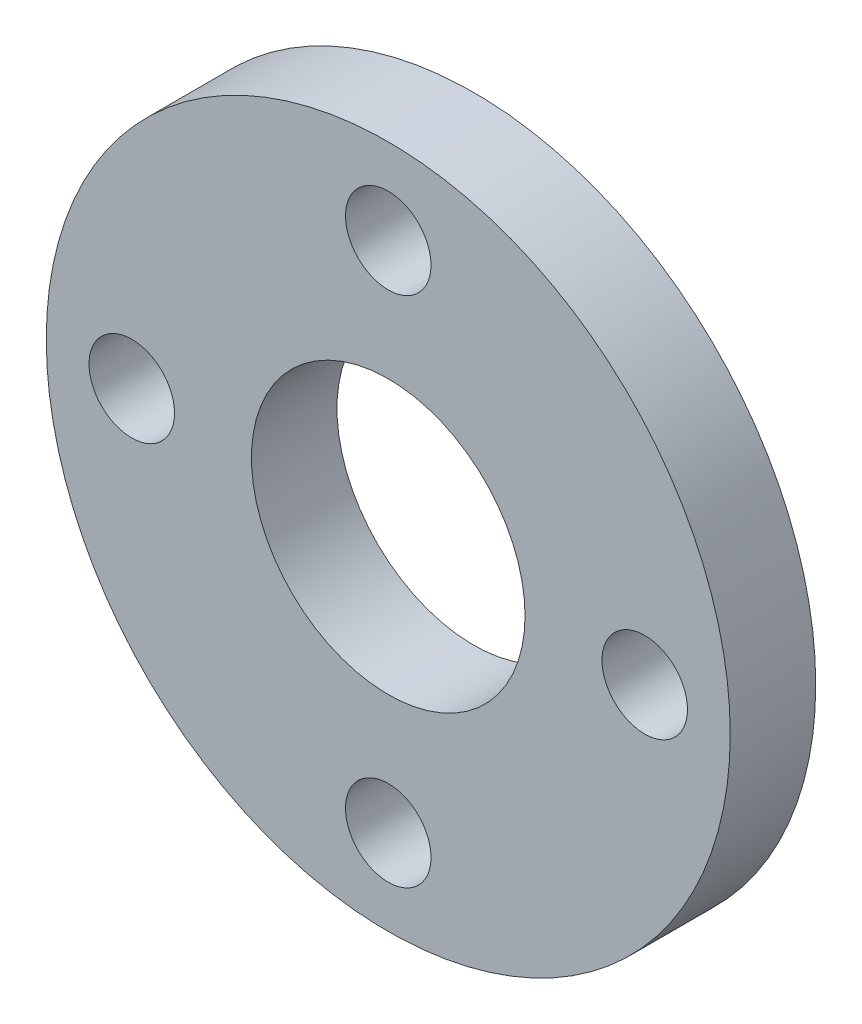
from build123d import *

# Parameters (mm, degrees)
SKETCH1_R           = 25.4
SKETCH1_R_2         = 10.16
SKETCH1_R_3         = 3.175
BOSS_EXTRUDE1_DEPTH = 6.35


with BuildPart() as part:
    # Sketch1 → Boss-Extrude1 (new body)
    with BuildSketch(Plane.XY):
        with Locations((0, 228.6)):
            Circle(SKETCH1_R)
        with Locations((0, 228.6)):
            Circle(SKETCH1_R_2, mode=Mode.SUBTRACT)
        with Locations((0, 247.65)):
            Circle(SKETCH1_R_3, mode=Mode.SUBTRACT)
        with Locations((19.05, 228.6)):
            Circle(SKETCH1_R_3, mode=Mode.SUBTRACT)
        with Locations((0, 209.55)):
            Circle(SKETCH1_R_3, mode=Mode.SUBTRACT)
        with Locations((-19.05, 228.6)):
            Circle(SKETCH1_R_3, mode=Mode.SUBTRACT)
    extrude(amount=BOSS_EXTRUDE1_DEPTH)


solid = part.part
